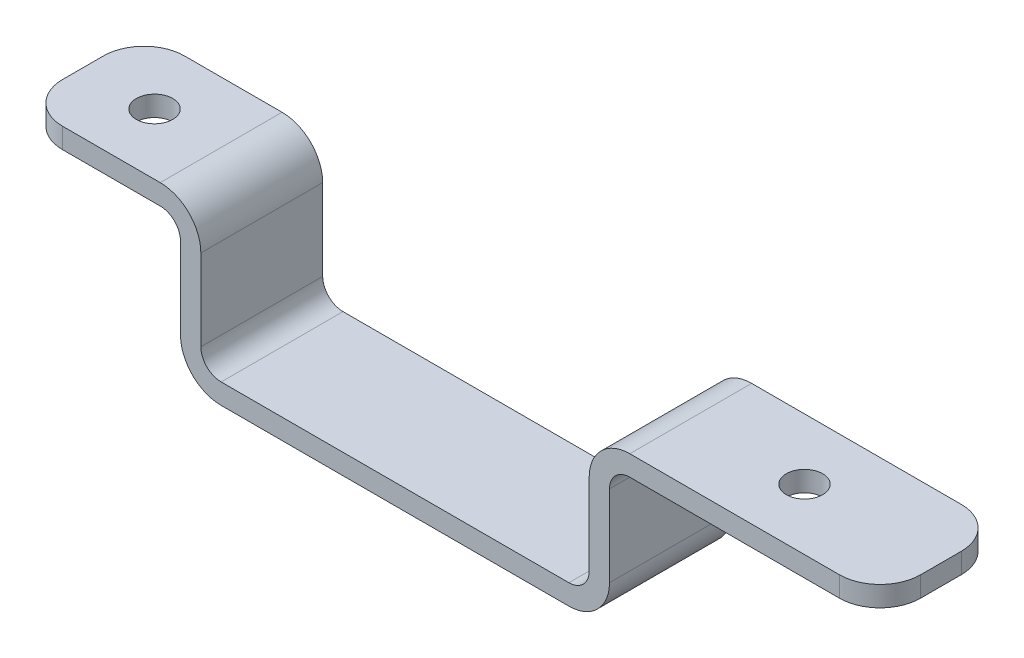
from build123d import *

# Parameters (mm, degrees)
BOSS_EXTRUDE1_DEPTH = 4.7625
FILLET1_R           = 1.5875
FILLET2_R           = 3.175
FILLET3_R           = 3.175
HOLE1_D             = 2.8448
HOLE2_D             = 2.8448


with BuildPart() as part:
    # Sketch1 → Boss-Extrude1 (new, symmetric)
    with BuildSketch(Plane.XY):
        Polygon((-29.1465, 11.1125), (-16.764, 11.1125), (-16.764, 0), (16.764, 0), (16.764, 11.1125), (37.9095, 11.1125), (37.9095, 12.7), (15.1765, 12.7), (15.1765, 1.5875), (-15.1765, 1.5875), (-15.1765, 12.7), (-29.1465, 12.7), align=None)
    extrude(amount=BOSS_EXTRUDE1_DEPTH, both=True)

    # Fillet1
    fillet1_edges = [part.edges().sort_by_distance(p)[0] for p in [
        (-16.764, 11.1125, 0),
        (16.764, 11.1125, 0),
        (15.1765, 1.5875, 0),
        (-15.1765, 1.5875, 0),
    ]]
    fillet(fillet1_edges, radius=FILLET1_R)

    # Fillet2
    fillet2_edges = [part.edges().sort_by_distance(p)[0] for p in [
        (-16.764, 0, 0),
        (16.764, 0, 0),
        (15.1765, 12.7, 0),
        (-15.1765, 12.7, 0),
    ]]
    fillet(fillet2_edges, radius=FILLET2_R)

    # Fillet3
    fillet3_edges = [part.edges().sort_by_distance(p)[0] for p in [
        (37.9095, 11.90625, -4.7625),
        (37.9095, 11.90625, 4.7625),
        (-29.1465, 11.90625, -4.7625),
        (-29.1465, 11.90625, 4.7625),
    ]]
    fillet(fillet3_edges, radius=FILLET3_R)

    # Hole1 (through all)
    with Locations(Plane.XZ.offset(-11.1125)):
        with Locations((27.2415, 0)):
            Hole(HOLE1_D / 2)

    # Hole2 (through all)
    with Locations(Plane.XZ.offset(-11.1125)):
        with Locations((-23.5585, 0)):
            Hole(HOLE2_D / 2)


solid = part.part
